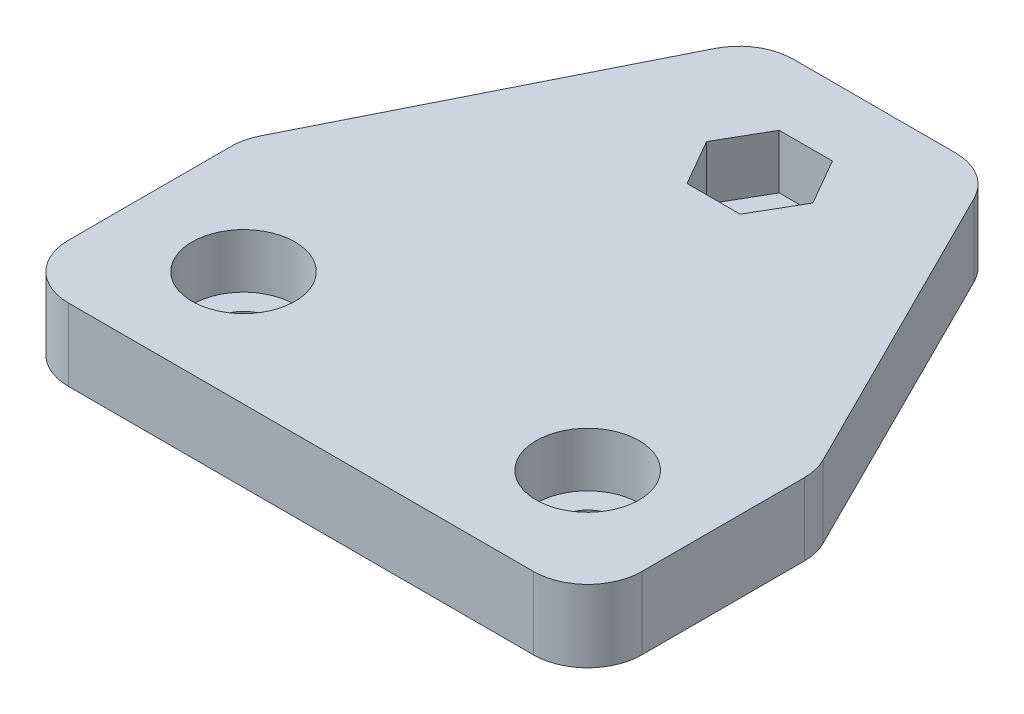
from build123d import *

# Parameters (mm, degrees)
BOSS_EXTRUDE1_DEPTH     = 8
CUT_EXTRUDE1_DEPTH      = 72.444471445
CUT_EXTRUDE1_DEPTH_BACK = 72.444471445
SKETCH2_R               = 3.1
FILLET1_R               = 6
CUT_EXTRUDE2_DEPTH      = 72.444471445
CUT_EXTRUDE2_DEPTH_BACK = 6
SKETCH3_R               = 5.7


with BuildPart() as part:
    # Sketch1 → Boss-Extrude1 (new body)
    with BuildSketch(Plane(origin=(0, 0, 0), x_dir=(1, 0, 0), z_dir=(0, 1, 0))):
        Polygon((-31.75, 0), (31.75, 0), (31.75, 25.4), (12.7, 63.5), (-12.7, 63.5), (-31.75, 25.4), align=None)
    extrude(amount=BOSS_EXTRUDE1_DEPTH)

    # Sketch2 → Cut-Extrude1 (cut, two sides: drawn at the far end of the back side and taken through both)
    with BuildSketch(Plane(origin=(0, 8, 0), x_dir=(1, 0, 0), z_dir=(0, 1, 0)).offset(-CUT_EXTRUDE1_DEPTH_BACK)):
        with Locations((0, 50.8)):
            Circle(SKETCH2_R)
        with Locations((-19.05, 12.7)):
            Circle(SKETCH2_R)
        with Locations((19.05, 12.7)):
            Circle(SKETCH2_R)
    extrude(amount=CUT_EXTRUDE1_DEPTH + CUT_EXTRUDE1_DEPTH_BACK, mode=Mode.SUBTRACT)

    # Fillet1
    fillet1_edges = [part.edges().sort_by_distance(p)[0] for p in [
        (-12.7, 4, -63.5),
        (12.7, 4, -63.5),
        (31.75, 4, -25.4),
        (31.75, 4, 0),
        (-31.75, 4, 0),
        (-31.75, 4, -25.4),
    ]]
    fillet(fillet1_edges, radius=FILLET1_R)

    # Sketch3 → Cut-Extrude2 (cut, two sides: drawn at the far end of the back side and taken through both)
    with BuildSketch(Plane(origin=(0, 8, 0), x_dir=(1, 0, 0), z_dir=(0, 1, 0)).offset(-CUT_EXTRUDE2_DEPTH_BACK)):
        with Locations((-19.05, 12.7)):
            Circle(SKETCH3_R)
        with Locations((19.05, 12.7)):
            Circle(SKETCH3_R)
        Polygon((5.888972746, 50.8), (2.944486373, 55.9), (-2.944486373, 55.9), (-5.888972746, 50.8), (-2.944486373, 45.7), (2.944486373, 45.7), align=None)
    extrude(amount=CUT_EXTRUDE2_DEPTH + CUT_EXTRUDE2_DEPTH_BACK, mode=Mode.SUBTRACT)


solid = part.part
